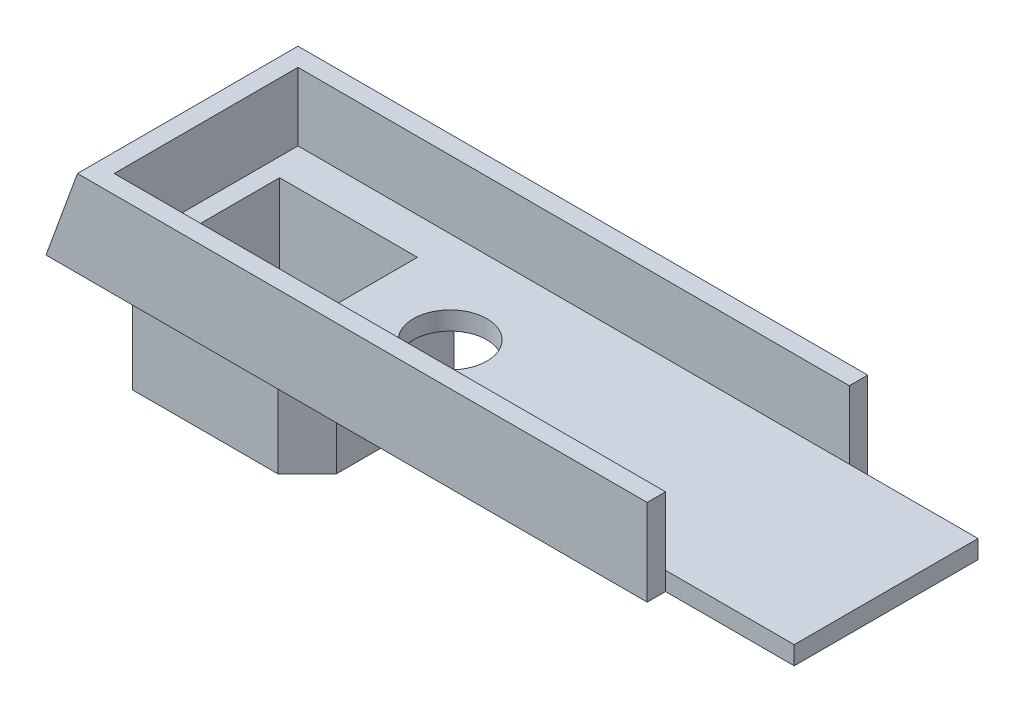
from build123d import *

# Parameters (mm, degrees)
EXTRUDE_1_DEPTH     = 1
EXTRUDE_2_DEPTH     = 6
SKETCH_3_R          = 2
CUT_EXTRUDE_1_DEPTH = 1
EXTRUDE_3_DEPTH     = 3.7
EXTRUDE_4_DEPTH     = 12


with BuildPart() as part:
    # 草图1 → 凸台-拉伸1 (new body)
    with BuildSketch(Plane(origin=(0, 0, 0), x_dir=(1, 0, 0), z_dir=(0, 1, 0))):
        Polygon((23.47582205, -4.484524381), (23.47582205, -14.484524381), (16.47582205, -14.484524381), (16.47582205, -15.484524381), (2.97582205, -15.484524381), (-4.02417795, -15.484524381), (-14.52417795, -15.484524381), (-14.52417795, -3.484524381), (-4.02417795, -3.484524381), (2.97582205, -3.484524381), (16.47582205, -3.484524381), (16.47582205, -4.484524381), align=None)
        Polygon((-12.52417795, -6.484524381), (-12.52417795, -12.484524381), (-6.02417795, -12.484524381), (-5.02417795, -11.484524381), (-5.02417795, -6.484524381), align=None, mode=Mode.SUBTRACT)
    extrude(amount=EXTRUDE_1_DEPTH)

    # 草图2 → 凸台-拉伸2 (add)
    with BuildSketch(Plane.XZ):
        Polygon((-13.52417795, 5.484524381), (-13.52417795, 13.484524381), (-5.609964387, 13.484524381), (-4.02417795, 11.898737944), (-4.02417795, 5.484524381), align=None)
        Polygon((-12.52417795, 12.484524381), (-6.02417795, 12.484524381), (-5.02417795, 11.484524381), (-5.02417795, 6.484524381), (-12.52417795, 6.484524381), align=None, mode=Mode.SUBTRACT)
    extrude(amount=EXTRUDE_2_DEPTH)

    # 草图3 → 切除-拉伸1 (cut)
    with BuildSketch(Plane(origin=(0, 1, 0), x_dir=(1, 0, 0), z_dir=(0, 1, 0))):
        with Locations((-0.24417795, -9.484524381)):
            Circle(SKETCH_3_R)
    extrude(amount=-CUT_EXTRUDE_1_DEPTH, mode=Mode.SUBTRACT)

    # 草图4 → 凸台-拉伸3 (add)
    with BuildSketch(Plane(origin=(0, 1, 0), x_dir=(1, 0, 0), z_dir=(0, 1, 0))):
        Polygon((-14.52417795, -3.484524381), (16.47582205, -3.484524381), (16.47582205, -4.484524381), (-13.52417795, -4.484524381), (-13.52417795, -14.484524381), (16.47582205, -14.484524381), (16.47582205, -15.484524381), (-14.52417795, -15.484524381), align=None)
    extrude(amount=EXTRUDE_3_DEPTH)

    # 草图7 → 凸台-拉伸4 (add)
    with BuildSketch(Plane.XY.offset(15.484524381)):
        Polygon((-14.52417795, 0), (-14.52417795, 4.7), (-16.234838051, 0), align=None)
    extrude(amount=-EXTRUDE_4_DEPTH)


solid = part.part
